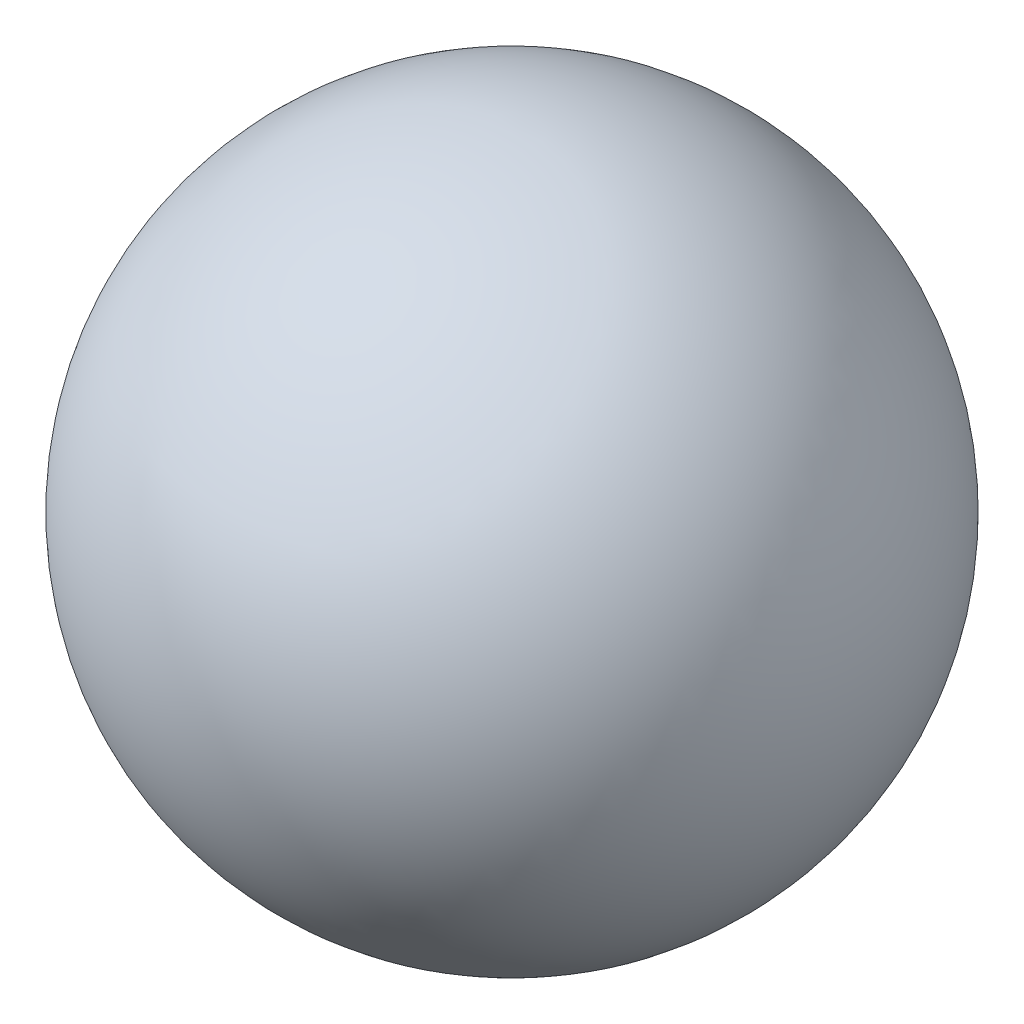
from build123d import *


with BuildPart() as part:
    # 草图1 → Revolve 210 (revolve)
    with BuildSketch(Plane.XY):
        with BuildLine():
            Line((0, -35), (0, 35))
            ThreePointArc((0, 35), (35, 0), (0, -35))
        make_face()
    revolve(axis=Axis((0, -35, 0), (0, 1, 0)))


solid = part.part
